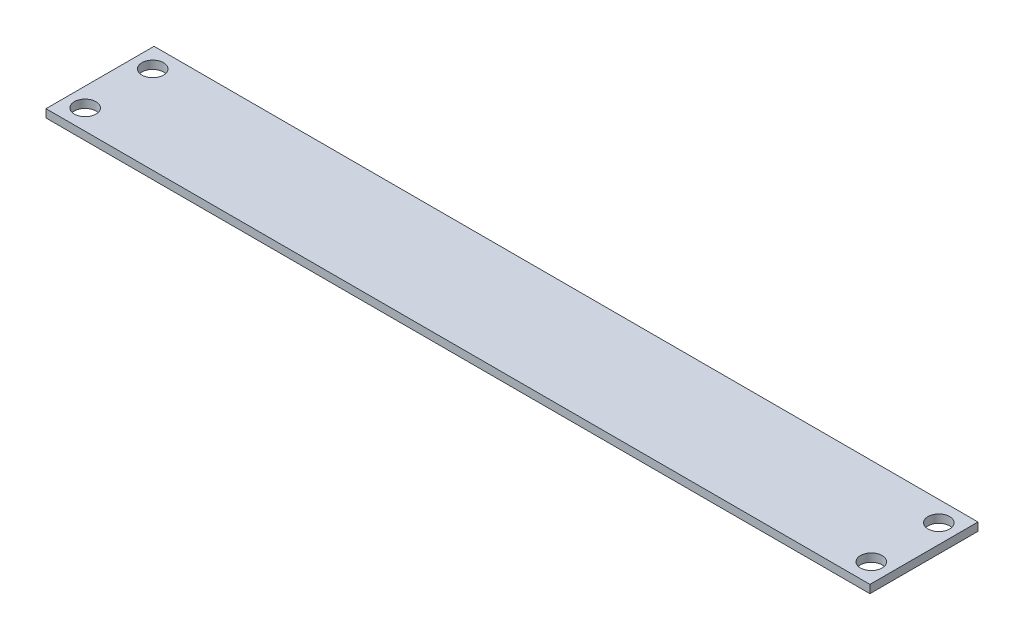
from build123d import *

# Parameters (mm, degrees)
SKETCH1_W          = 305
SKETCH1_H          = 40
SKETCH1_R          = 4
BASE_FLANGE1_DEPTH = 3


# Sheet-metal steps are written as plain solids
with BuildPart() as part:
    # Sketch1 → Base-Flange1 (new body)
    with BuildSketch(Plane(origin=(0, 0, 0), x_dir=(1, 0, 0), z_dir=(0, 1, 0))):
        with Locations((152.5, 20)):
            Rectangle(SKETCH1_W, SKETCH1_H)
        with Locations(Location((7, 32.5, 0), (0, 0, 270))):
            Circle(SKETCH1_R, mode=Mode.SUBTRACT)
        with Locations(Location((7, 7.5, 0), (0, 0, 270))):
            Circle(SKETCH1_R, mode=Mode.SUBTRACT)
        with Locations(Location((298, 32.5, 0), (0, 0, 270))):
            Circle(SKETCH1_R, mode=Mode.SUBTRACT)
        with Locations(Location((298, 7.5, 0), (0, 0, 270))):
            Circle(SKETCH1_R, mode=Mode.SUBTRACT)
    extrude(amount=-BASE_FLANGE1_DEPTH)


solid = part.part
